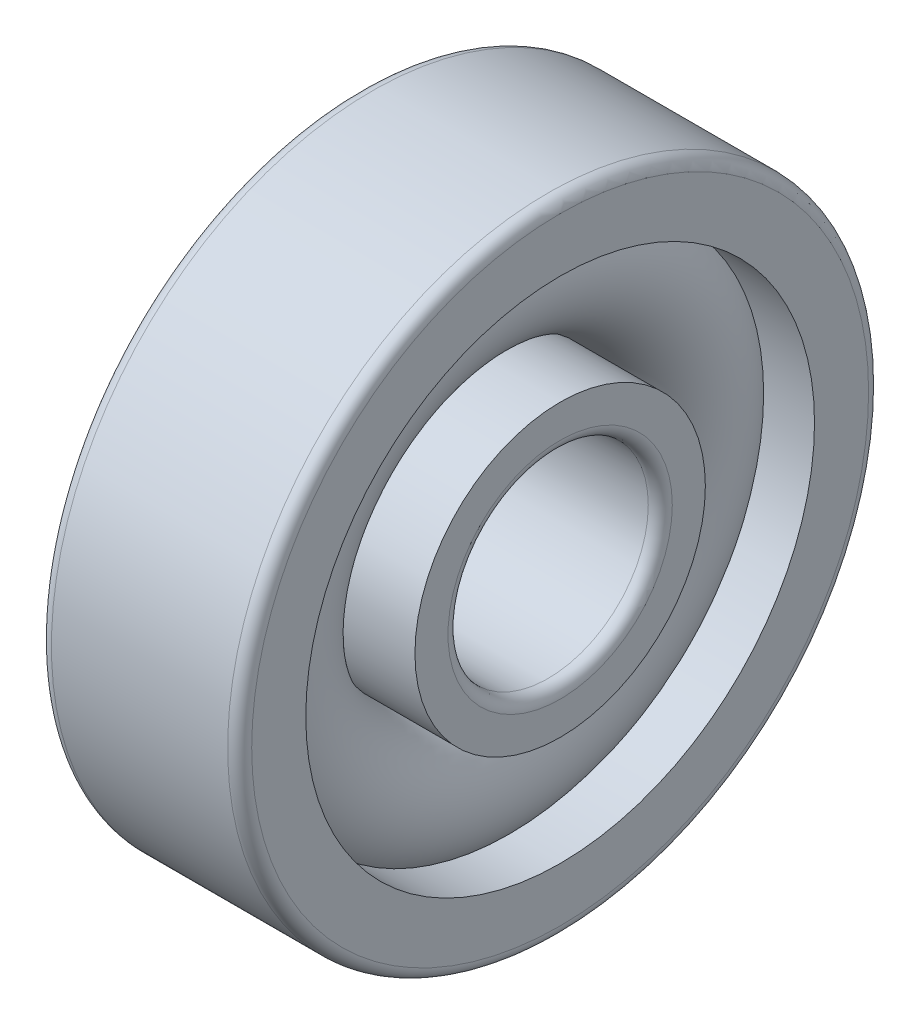
from build123d import *

# Parameters (mm, degrees)
CAGSPISKE_W     = 0.825
CAGSPISKE_H     = 0.55
CAGESPINE_ANGLE = 0.001
BALSIMSKE_R     = 1.65


with BuildPart() as part:
    # CagSpiSke → CageSpine (revolve)
    with BuildSketch(Plane.XY):
        with Locations((0, 5.25)):
            Rectangle(CAGSPISKE_W, CAGSPISKE_H)
    revolve(axis=Axis((-20.6375, 0, 0), (1, 0, 0)), revolution_arc=CAGESPINE_ANGLE)

    # BalSimSke → BallsSimplified (revolve)
    with BuildSketch(Plane.XY):
        with Locations((0, 5.25)):
            Circle(BALSIMSKE_R)
    revolve(axis=Axis((-10, 0, 0), (1, 0, 0)))

    # InnRacSke → InnerRace (revolve)
    with BuildSketch(Plane.XY):
        with BuildLine():
            Line((-1.196087371, 4.15), (-2.5, 4.15))
            Line((-2.5, 4.15), (-2.5, 2.8))
            ThreePointArc((-2.5, 2.8), (-2.412132034, 2.587867966), (-2.2, 2.5))
            Line((-2.2, 2.5), (2.2, 2.5))
            ThreePointArc((2.2, 2.5), (2.412132034, 2.587867966), (2.5, 2.8))
            Line((2.5, 2.8), (2.5, 3.625))
            Line((2.5, 3.625), (0, 3.625))
            ThreePointArc((0, 3.625), (-0.653117524, 3.762027386), (-1.196087371, 4.15))
        make_face()
    revolve(axis=Axis((-20.6375, 0, 0), (1, 0, 0)))

    # OutRacSke → OuterRace (revolve)
    with BuildSketch(Plane.XY):
        with BuildLine():
            Line((0, 6.875), (-2.5, 6.875))
            Line((-2.5, 6.875), (-2.5, 7.7))
            ThreePointArc((-2.5, 7.7), (-2.412132034, 7.912132034), (-2.2, 8))
            Line((-2.2, 8), (2.2, 8))
            ThreePointArc((2.2, 8), (2.412132034, 7.912132034), (2.5, 7.7))
            Line((2.5, 7.7), (2.5, 6.35))
            Line((2.5, 6.35), (1.196087371, 6.35))
            ThreePointArc((1.196087371, 6.35), (0.653117524, 6.737972614), (0, 6.875))
        make_face()
    revolve(axis=Axis((-20.6375, 0, 0), (1, 0, 0)))


solid = part.part
